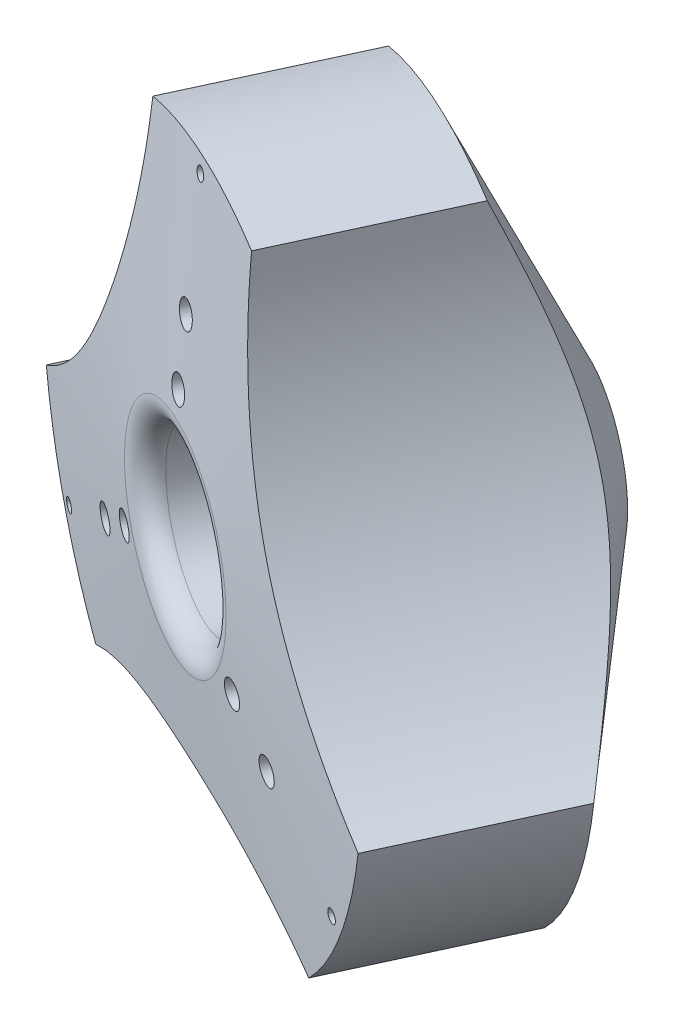
from build123d import *

# Parameters (mm, degrees)
SKETCH_2_R               = 72.5
SKETCH_2_R_2             = 1
SKETCH_2_R_3             = 2
SKETCH_2_R_4             = 12.5
CUT_EXTRUDE_1_DEPTH      = 60
FILLET_1_R               = 3.5
SHELL_1_T                = 2
SKETCH_3_W               = 39.524409176
SKETCH_3_H               = 2.874297138
SKETCH_3_W_2             = 45.172462829
SKETCH_3_H_2             = 2.396913119
EXTRUDE_1_DEPTH          = 0.5
PATTERN_CIRCULAR_1_COUNT = 3


with BuildPart() as part:
    # 草图1 → 旋转1 (revolve)
    with BuildSketch(Plane(origin=(0, 0, 0), x_dir=(1, 0, 0), z_dir=(0, 1, 0))):
        Polygon((43.903980949, -25.347975225), (79.756208548, -46.047268485), (101.005851399, 0), (55.6014266, 0), align=None)
    revolve(axis=Axis((88.452638148, 0, 51.068154457), (0.4190103427559103, 0, -0.9079814605285588)))

    # 草图2 → 切除-拉伸1 (cut)
    with BuildSketch(Plane(origin=(-3.516079121, 0, 7.619226377), x_dir=(0.9079814605285589, 0, 0.41901034275590987), z_dir=(-0.41901034275590987, 0, 0.9079814605285589))):
        with Locations((13.37684929, 51)):
            Circle(SKETCH_2_R)
        with Locations((101.711440476, 48.726375944)):
            Circle(SKETCH_2_R_2)
        with Locations((101.711440476, 30)):
            Circle(SKETCH_2_R_3)
        with Locations((101.711440476, 20)):
            Circle(SKETCH_2_R_3)
        with Locations((190.046031662, 51)):
            Circle(SKETCH_2_R)
        with Locations((143.909719878, -24.363187972)):
            Circle(SKETCH_2_R_2)
        with Locations((127.692202589, -15)):
            Circle(SKETCH_2_R_3)
        with Locations((119.031948551, -10)):
            Circle(SKETCH_2_R_3)
        with Locations((101.711440476, -102)):
            Circle(SKETCH_2_R)
        with Locations((59.513161074, -24.363187972)):
            Circle(SKETCH_2_R_2)
        with Locations((75.730678362, -15)):
            Circle(SKETCH_2_R_3)
        with Locations((84.3909324, -10)):
            Circle(SKETCH_2_R_3)
        with Locations((101.711440476, 0)):
            Circle(SKETCH_2_R_4)
    extrude(amount=-CUT_EXTRUDE_1_DEPTH, mode=Mode.SUBTRACT)

    # 圆角1
    fillet_1_edges = [part.edges().sort_by_distance(p)[0] for p in [
        (88.931869406, 12.499999999, 50.029676277),
    ]]
    fillet(fillet_1_edges, radius=FILLET_1_R)

    # 抽壳1 (no face opened: a closed hollow body)
    add(offset(amount=-SHELL_1_T, mode=Mode.PRIVATE), mode=Mode.SUBTRACT)

    # 草图3 → 凸台-拉伸1 (add, symmetric)
    with BuildSketch(Plane(origin=(92.352102276, 0, 42.618145536), x_dir=(0.4190103427559099, 0, -0.9079814605285589), z_dir=(0.9079814605285589, 0, 0.4190103427559099))):
        with Locations((14.447174479, 24.722193296)):
            Rectangle(SKETCH_3_W, SKETCH_3_H)
        with Locations((16.217968839, 15.055166905)):
            Rectangle(SKETCH_3_W_2, SKETCH_3_H_2)
    extrude_1 = extrude(amount=EXTRUDE_1_DEPTH, both=True)

    # 阵列(圆周)1: 凸台-拉伸1 ×3 about axis
    pattern_circular_1_axis = Axis((106.255279552, 0, 12.490423328), (-0.4190103427559099, 0, 0.9079814605285589))
    for i in range(1, PATTERN_CIRCULAR_1_COUNT):
        add(extrude_1.rotate(pattern_circular_1_axis, i * 360 / PATTERN_CIRCULAR_1_COUNT))


solid = part.part
